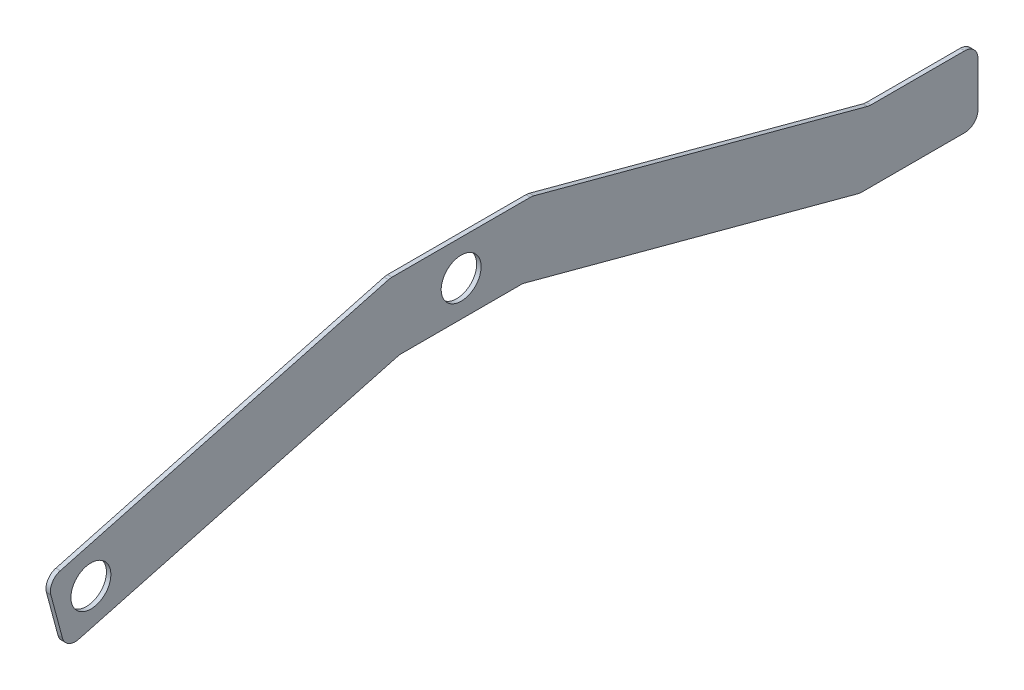
from build123d import *

# Parameters (mm, degrees)
SKETCH1_R           = 14.2875
BOSS_EXTRUDE1_DEPTH = 3.175
SKETCH3_R           = 12.7
CUT_EXTRUDE2_DEPTH  = 501.923776165
SKETCH5_W           = 50.8
SKETCH5_H           = 247.65
CUT_EXTRUDE4_DEPTH  = 501.923776165
SKETCH6_W           = 127
SKETCH6_H           = 25.4
CUT_EXTRUDE5_DEPTH  = 384.019234201
BOSS_EXTRUDE2_DEPTH = 3.175
FILLET1_R           = 9.525


with BuildPart() as part:
    # Sketch1 → Boss-Extrude1 (new body)
    with BuildSketch(Plane(origin=(0, 0, 0), x_dir=(0, 0, -1), z_dir=(1, 0, 0))):
        Polygon((-50.8, 25.4), (50.8, 25.4), (369.963359856, -60.119564527), (369.963359856, -337.700549698), (319.163359856, -337.700549698), (319.163359856, -99.099775516), (44.112053123, -25.4), (-44.112053123, -25.4), (-282.997152386, -89.409069432), (-296.145159877, -40.340037456), align=None)
        with Locations((-265.036640144, -58.300549698)):
            Circle(SKETCH1_R, mode=Mode.SUBTRACT)
        Circle(SKETCH1_R, mode=Mode.SUBTRACT)
    extrude(amount=BOSS_EXTRUDE1_DEPTH)

    # Sketch3 → Cut-Extrude2 (cut, through all)
    with BuildSketch(Plane(origin=(3.175, 0, 0), x_dir=(0, 0, -1), z_dir=(1, 0, 0))):
        with Locations((344.563359856, -312.300549698)):
            Circle(SKETCH3_R)
    extrude(amount=-CUT_EXTRUDE2_DEPTH, mode=Mode.SUBTRACT)

    # Sketch5 → Cut-Extrude4 (cut, through all)
    with BuildSketch(Plane(origin=(3.175, 0, 0), x_dir=(0, 0, -1), z_dir=(1, 0, 0))):
        with Locations((344.563359856, -213.875549698)):
            Rectangle(SKETCH5_W, SKETCH5_H)
    extrude(amount=-CUT_EXTRUDE4_DEPTH, mode=Mode.SUBTRACT)

    # Sketch6 → Cut-Extrude5 (cut, through all)
    with BuildSketch(Plane(origin=(3.175, 0, 0), x_dir=(0, 0, -1), z_dir=(1, 0, 0))):
        with Locations((306.463359856, -102.750549698)):
            Rectangle(SKETCH6_W, SKETCH6_H)
    extrude(amount=-CUT_EXTRUDE5_DEPTH, mode=Mode.SUBTRACT)

    # Sketch7 → Boss-Extrude2 (add)
    with BuildSketch(Plane(origin=(3.175, 0, 0), x_dir=(0, 0, -1), z_dir=(1, 0, 0))):
        Polygon((292.079136211, -39.250549698), (369.963359856, -39.250549698), (369.963359856, -60.119564527), align=None)
    extrude(amount=-BOSS_EXTRUDE2_DEPTH)

    # Fillet1
    fillet1_edges = [part.edges().sort_by_distance(p)[0] for p in [
        (1.5875, -39.250549698, -369.963359856),
        (1.5875, -90.050549698, -369.963359856),
        (1.5875, -90.050549698, -285.391189333),
        (1.5875, -39.250549698, -292.079136211),
        (1.5875, -25.4, -44.112053123),
        (1.5875, -25.4, 44.112053123),
        (1.5875, 25.4, -50.8),
        (1.5875, 25.4, 50.8),
        (1.5875, -89.409069432, 282.997152386),
        (1.5875, -40.340037456, 296.145159877),
    ]]
    fillet(fillet1_edges, radius=FILLET1_R)


solid = part.part
